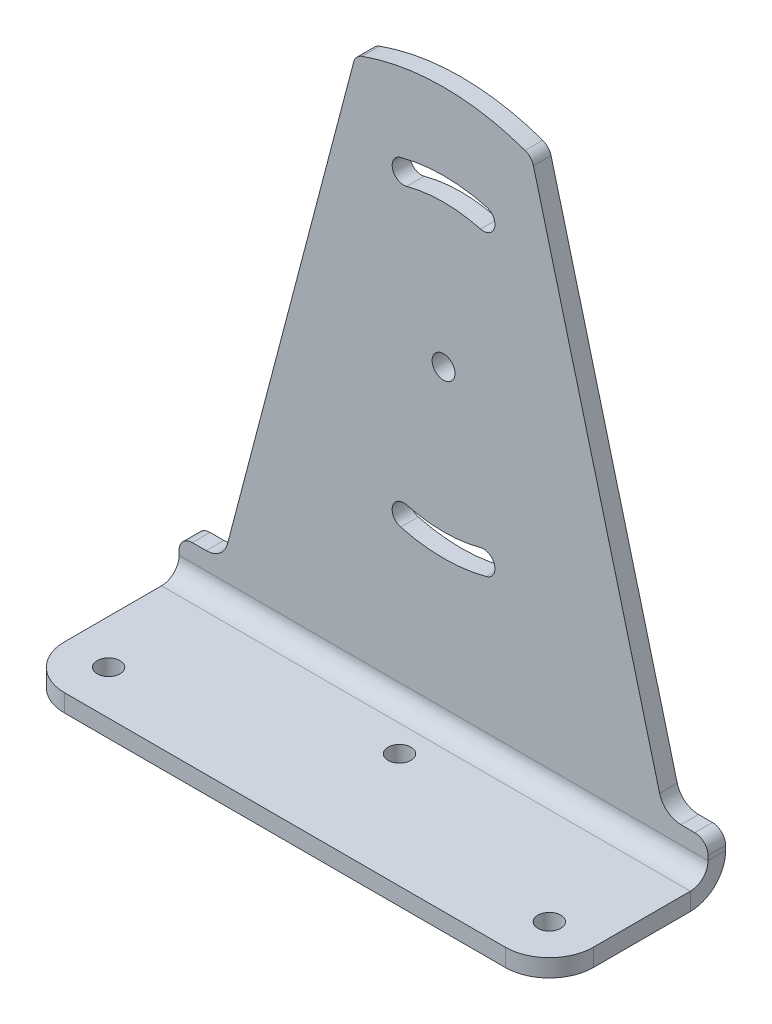
from build123d import *

# Parameters (mm, degrees)
SKETCH_13_R                      = 2.6
SM_BASE_FLANGE_2_DEPTH           = 4
SM_EDGE_FLANGE_2_STRIP_W         = 24
SM_EDGE_FLANGE_2_STRIP_H         = 4
SM_EDGE_FLANGE_2_STRIP_CUT_DEPTH = 120
SM_EDGE_FLANGE_2_DEPTH           = 120
FILLET_1_R                       = 5
FILLET_2_R                       = 3
FILLET_3_R                       = 10
SKETCH_23_R                      = 2.6
CUT_EXTRUDE_2_DEPTH              = 10


# Sheet-metal steps are written as plain solids
with BuildPart() as part:
    # Эскиз13 → Базовая кромка2 (new body)
    with BuildSketch(Plane.XY):
        with BuildLine():
            Line((-60, 0), (60, 0))
            Line((60, 0), (60, 12))
            Line((60, 12), (50, 12))
            Line((50, 12), (20, 126.23475383))
            ThreePointArc((20, 126.23475383), (0, 130), (-20, 126.23475383))
            Line((-20, 126.23475383), (-50, 12))
            Line((-50, 12), (-60, 12))
            Line((-60, 12), (-60, 0))
        make_face()
        with Locations((0, 75)):
            Circle(SKETCH_13_R, mode=Mode.SUBTRACT)
        with BuildLine():
            ThreePointArc((9.731596096, 111.318811068), (0, 112.6), (-9.731596096, 111.318811068))
            ThreePointArc((-9.731596096, 111.318811068), (-11.570073727, 108.134474403), (-8.385737061, 106.295996772))
            ThreePointArc((-8.385737061, 106.295996772), (0, 107.4), (8.385737061, 106.295996772))
            ThreePointArc((8.385737061, 106.295996772), (11.570073727, 108.134474403), (9.731596096, 111.318811068))
        make_face(mode=Mode.SUBTRACT)
        with BuildLine():
            ThreePointArc((-9.731596096, 38.681188932), (0, 37.4), (9.731596096, 38.681188932))
            ThreePointArc((9.731596096, 38.681188932), (11.570073727, 41.865525597), (8.385737061, 43.704003228))
            ThreePointArc((8.385737061, 43.704003228), (0, 42.6), (-8.385737061, 43.704003228))
            ThreePointArc((-8.385737061, 43.704003228), (-11.570073727, 41.865525597), (-9.731596096, 38.681188932))
        make_face(mode=Mode.SUBTRACT)
    extrude(amount=-SM_BASE_FLANGE_2_DEPTH)

    # Ребро-кромка2 strip (across the edge) → Ребро-кромка2 strip cut (cut)
    with BuildSketch(Plane.YZ.offset(-60)):
        with Locations((-4, -2)):
            Rectangle(SM_EDGE_FLANGE_2_STRIP_W, SM_EDGE_FLANGE_2_STRIP_H)
    extrude(amount=SM_EDGE_FLANGE_2_STRIP_CUT_DEPTH, mode=Mode.SUBTRACT)

    # Ребро-кромка2 section (across the edge) → Ребро-кромка2 (add)
    with BuildSketch(Plane.YZ.offset(-60)):
        with BuildLine():
            Line((0, 4), (0, 36))
            Line((0, 36), (4, 36))
            Line((4, 36), (4, 4))
            ThreePointArc((4, 4), (5.171572875, 1.171572875), (8, 0))
            Line((8, 0), (8, -4))
            ThreePointArc((8, -4), (2.343145751, -1.656854249), (0, 4))
        make_face()
    extrude(amount=SM_EDGE_FLANGE_2_DEPTH)

    # Скругление1
    fillet_1_edges = [part.edges().sort_by_distance(p)[0] for p in [
        (-50, 12, -2),
        (50, 12, -2),
    ]]
    fillet(fillet_1_edges, radius=FILLET_1_R)

    # Скругление2
    fillet_2_edges = [part.edges().sort_by_distance(p)[0] for p in [
        (-60, 12, -2),
        (-20, 126.23475383, -2),
        (20, 126.23475383, -2),
        (60, 12, -2),
    ]]
    fillet(fillet_2_edges, radius=FILLET_2_R)

    # Скругление3
    fillet_3_edges = [part.edges().sort_by_distance(p)[0] for p in [
        (-60, 2, 36),
        (60, 2, 36),
    ]]
    fillet(fillet_3_edges, radius=FILLET_3_R)

    # Эскиз23 → Вырез-Вытянуть2 (cut)
    with BuildSketch(Plane(origin=(0, 4, 0), x_dir=(1, 0, 0), z_dir=(0, 1, 0))):
        with Locations(Location((-50, -26, 0), (0, 0, 270))):
            Circle(SKETCH_23_R)
        with Locations(Location((50, -26, 0), (0, 0, 270))):
            Circle(SKETCH_23_R)
        with Locations(Location((0, -10, 0), (0, 0, 270))):
            Circle(SKETCH_23_R)
    extrude(amount=-CUT_EXTRUDE_2_DEPTH, mode=Mode.SUBTRACT)


solid = part.part
